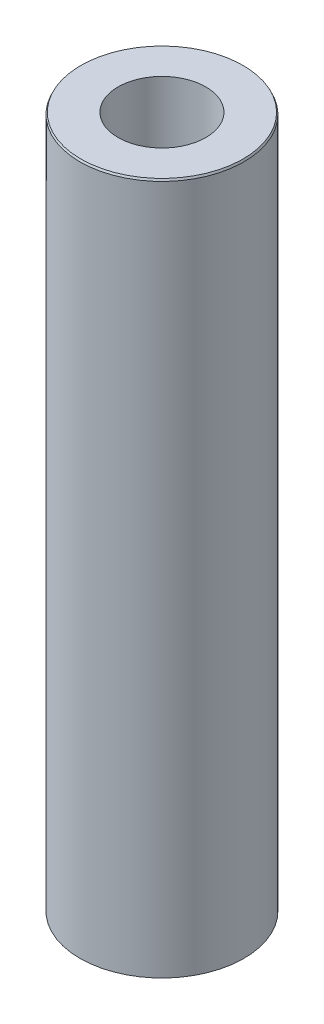
from build123d import *
from OCP.BRepFilletAPI import BRepFilletAPI_MakeChamfer

# Parameters (mm, degrees)
SKETCH1_R           = 60
BOSS_EXTRUDE1_DEPTH = 506.756488005
SKETCH2_R           = 32.106981056
CUT_EXTRUDE1_DEPTH  = 514.811383812
CHAMFER1_SIZE       = 1.44881982
CHAMFER1_SIZE2      = 0.679001022


with BuildPart() as part:
    # Sketch1 → Boss-Extrude1 (new body)
    with BuildSketch(Plane(origin=(0, 0, 0), x_dir=(1, 0, 0), z_dir=(0, 1, 0))):
        Circle(SKETCH1_R)
    extrude(amount=BOSS_EXTRUDE1_DEPTH)

    # Sketch2 → Cut-Extrude1 (cut, through all)
    with BuildSketch(Plane(origin=(0, 0, 0), x_dir=(1, 0, 0), z_dir=(0, 1, 0))):
        Circle(SKETCH2_R)
    extrude(amount=CUT_EXTRUDE1_DEPTH, mode=Mode.SUBTRACT)

    # Chamfer1: one chamfer whose edges measure the first distance from different faces: ONE call of the kernel's chamfer builder (chamfer() names one face for all edges)
    chamfer1_edges_1 = [part.edges().sort_by_distance(p)[0] for p in [
        (-60, 506.756488005, 0),
    ]]
    chamfer1_side_1 = [part.faces().sort_by_distance(p)[0] for p in [
        (-60, 253.378244002, 0),
    ]]
    chamfer1_edges_2 = [part.edges().sort_by_distance(p)[0] for p in [
        (-60, 0, 0),
    ]]
    chamfer1_side_2 = [part.faces().sort_by_distance(p)[0] for p in [
        (-58.302943725, 0, 0),
    ]]
    chamfer1 = BRepFilletAPI_MakeChamfer(part.part.solid().wrapped)
    for e in chamfer1_edges_1:
        chamfer1.Add(CHAMFER1_SIZE, CHAMFER1_SIZE2, e.wrapped, chamfer1_side_1[0].wrapped)  # the first distance lies on this face
    for e in chamfer1_edges_2:
        chamfer1.Add(CHAMFER1_SIZE, CHAMFER1_SIZE2, e.wrapped, chamfer1_side_2[0].wrapped)  # the first distance lies on this face
    add(Compound.cast(chamfer1.Shape()), mode=Mode.REPLACE)


solid = part.part
